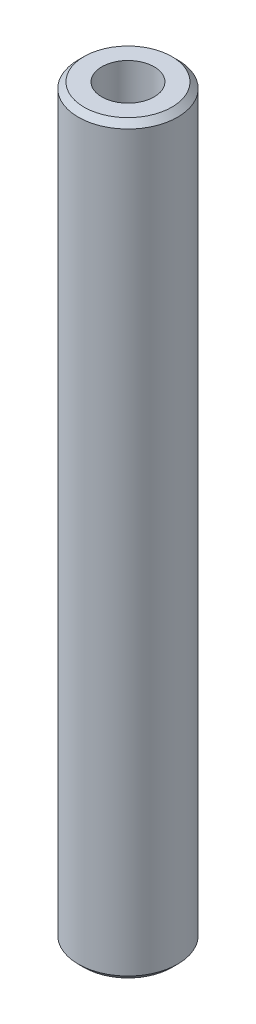
from build123d import *

# Parameters (mm, degrees)
SKETCH1_R           = 40
BOSS_EXTRUDE1_DEPTH = 600
SKETCH2_R           = 21.06343848
CUT_EXTRUDE1_DEPTH  = 603.660766933
CHAMFER1_SIZE       = 4.660271634


with BuildPart() as part:
    # Sketch1 → Boss-Extrude1 (new body)
    with BuildSketch(Plane(origin=(0, 0, 0), x_dir=(1, 0, 0), z_dir=(0, 1, 0))):
        Circle(SKETCH1_R)
    extrude(amount=BOSS_EXTRUDE1_DEPTH)

    # Sketch2 → Cut-Extrude1 (cut, through all)
    with BuildSketch(Plane(origin=(0, 0, 0), x_dir=(1, 0, 0), z_dir=(0, 1, 0))):
        Circle(SKETCH2_R)
    extrude(amount=CUT_EXTRUDE1_DEPTH, mode=Mode.SUBTRACT)

    # Chamfer1
    chamfer1_edges = [part.edges().sort_by_distance(p)[0] for p in [
        (-40, 600, 0),
        (-40, 0, 0),
    ]]
    chamfer(chamfer1_edges, length=CHAMFER1_SIZE)


solid = part.part
